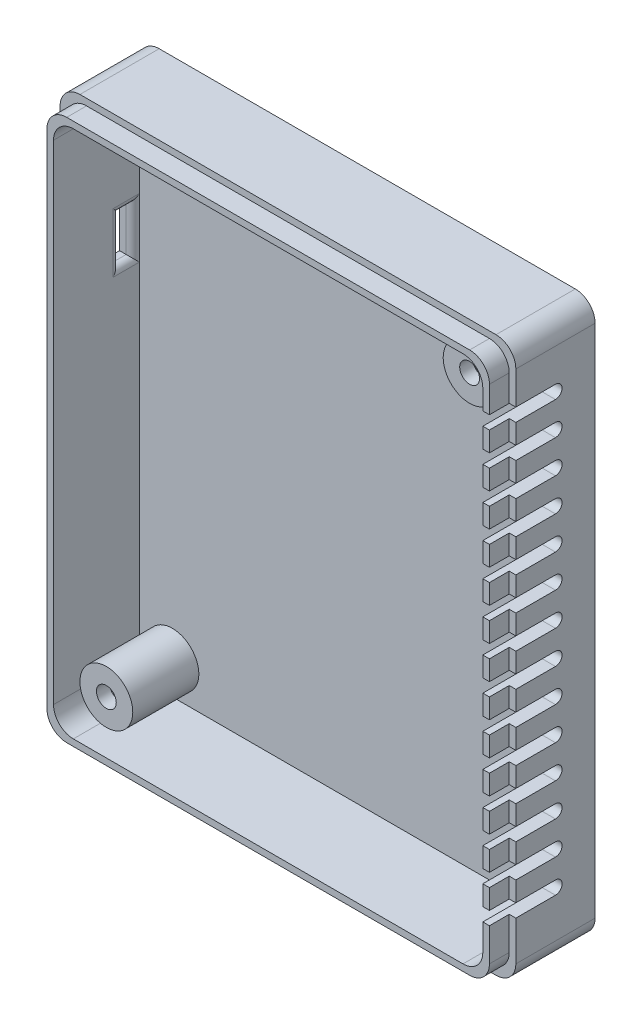
from build123d import *

# Parameters (mm, degrees)
SKETCH2_W           = 69
SKETCH2_H           = 84
SKETCH2_W_2         = 65
SKETCH2_H_2         = 80
BOSS_EXTRUDE1_DEPTH = 13
SKETCH3_OUTSIDE_W   = 92.896
SKETCH3_OUTSIDE_H   = 107.896
SKETCH3_OUTSIDE_W_2 = 67
SKETCH3_OUTSIDE_H_2 = 82
CUT_EXTRUDE1_DEPTH  = 3
SKETCH4_W           = 69
SKETCH4_H           = 84
BOSS_EXTRUDE2_DEPTH = 2
FILLET1_R           = 3
CUT_EXTRUDE2_DEPTH  = 3
LPATTERN1_COUNT     = 14
LPATTERN1_PITCH     = 5
SKETCH6_R           = 4
BOSS_EXTRUDE3_DEPTH = 10
CUT_EXTRUDE3_REACH  = 58.385
SKETCH7_R           = 3
FILLET2_R           = 2
BOSS_EXTRUDE4_START = -2
SKETCH8_R           = 4
SKETCH8_R_2         = 1.5
BOSS_EXTRUDE4_DEPTH = 2
SKETCH10_W          = 2
SKETCH10_H          = 7
CUT_EXTRUDE4_DEPTH  = 3
FILLET10_R          = 1


with BuildPart() as part:
    # Sketch2 → Boss-Extrude1 (new body)
    with BuildSketch(Plane.XY):
        Rectangle(SKETCH2_W, SKETCH2_H)
        Rectangle(SKETCH2_W_2, SKETCH2_H_2, mode=Mode.SUBTRACT)
    extrude(amount=BOSS_EXTRUDE1_DEPTH)

    # Sketch3 outside → Cut-Extrude1 (cut)
    with BuildSketch(Plane.XY.offset(13)):
        Rectangle(SKETCH3_OUTSIDE_W, SKETCH3_OUTSIDE_H)
        Rectangle(SKETCH3_OUTSIDE_W_2, SKETCH3_OUTSIDE_H_2, mode=Mode.SUBTRACT)
    extrude(amount=-CUT_EXTRUDE1_DEPTH, mode=Mode.SUBTRACT)

    # Sketch4 → Boss-Extrude2 (add)
    with BuildSketch(Plane(origin=(0, 0, 0), x_dir=(-1, 0, 0), z_dir=(0, 0, -1))):
        Rectangle(SKETCH4_W, SKETCH4_H)
    extrude(amount=BOSS_EXTRUDE2_DEPTH)

    # Fillet1
    fillet1_edges = [part.edges().sort_by_distance(p)[0] for p in [
        (32.5, -40, 6.5),
        (32.5, 40, 6.5),
        (-32.5, 40, 6.5),
        (-32.5, -40, 6.5),
        (34.5, -42, 4),
        (-34.5, -42, 4),
        (-34.5, 42, 4),
        (34.5, 42, 4),
        (33.5, -41, 11.5),
        (-33.5, -41, 11.5),
        (-33.5, 41, 11.5),
        (33.5, 41, 11.5),
    ]]
    fillet(fillet1_edges, radius=FILLET1_R)

    # Sketch5 → Cut-Extrude2 (cut)
    with BuildSketch(Plane(origin=(34.5, 0, 0), x_dir=(0, 0, -1), z_dir=(1, 0, 0))):
        with BuildLine():
            Line((-4, -33), (-13, -33))
            Line((-13, -33), (-13, -31))
            Line((-13, -31), (-4, -31))
            ThreePointArc((-4, -31), (-3, -32), (-4, -33))
        make_face()
    cut_extrude2 = extrude(amount=-CUT_EXTRUDE2_DEPTH, mode=Mode.SUBTRACT)

    # LPattern1: Cut-Extrude2 ×14
    with Locations(*[(0, i * LPATTERN1_PITCH, 0) for i in range(1, LPATTERN1_COUNT)]):
        add(cut_extrude2, mode=Mode.SUBTRACT)

    # Sketch6 → Boss-Extrude3 (add)
    with BuildSketch(Plane.XY):
        with Locations(Location((27.5, 35, 0), (0, 0, 180))):
            Circle(SKETCH6_R)
        with Locations(Location((-27.5, -35, 0), (0, 0, 180))):
            Circle(SKETCH6_R)
    extrude(amount=BOSS_EXTRUDE3_DEPTH)

    # Sketch7 → Cut-Extrude3 (cut, up to next)
    with BuildSketch(Plane(origin=(0, 0, -2), x_dir=(-1, 0, 0), z_dir=(0, 0, -1)), mode=Mode.PRIVATE) as cut_extrude3_sk1:
        with Locations((27.5, -35)):
            Circle(SKETCH7_R)
    cut_extrude3_tool1 = extrude(cut_extrude3_sk1.sketch, amount=-CUT_EXTRUDE3_REACH, mode=Mode.PRIVATE) & part.part
    # Sketch7 → Cut-Extrude3 (cut, up to next)
    with BuildSketch(Plane(origin=(0, 0, -2), x_dir=(-1, 0, 0), z_dir=(0, 0, -1)), mode=Mode.PRIVATE) as cut_extrude3_sk2:
        with Locations((-27.5, 35)):
            Circle(SKETCH7_R)
    cut_extrude3_tool2 = extrude(cut_extrude3_sk2.sketch, amount=-CUT_EXTRUDE3_REACH, mode=Mode.PRIVATE) & part.part
    add(cut_extrude3_tool1.solids().sort_by_distance((-27.5, -35, -2))[0], mode=Mode.SUBTRACT)
    add(cut_extrude3_tool2.solids().sort_by_distance((27.5, 35, -2))[0], mode=Mode.SUBTRACT)

    # Fillet2
    fillet2_edges = [part.edges().sort_by_distance(p)[0] for p in [
        (-24.5, -35, -2),
        (30.5, 35, -2),
    ]]
    fillet(fillet2_edges, radius=FILLET2_R)

    # Sketch8 → Boss-Extrude4 (add)
    # profile 1 of 2: a face of its own
    with BuildSketch(Plane.XY.offset(10).offset(BOSS_EXTRUDE4_START)):
        with Locations(Location((-27.5, -35, 0), (0, 0, 180))):
            Circle(SKETCH8_R)
        with Locations((-27.5, -35)):
            Circle(SKETCH8_R_2, mode=Mode.SUBTRACT)
    # profile 2 of 2: a face of its own
    with BuildSketch(Plane.XY.offset(10).offset(BOSS_EXTRUDE4_START)):
        with Locations(Location((27.5, 35, 0), (0, 0, 180))):
            Circle(SKETCH8_R)
        with Locations((27.5, 35)):
            Circle(SKETCH8_R_2, mode=Mode.SUBTRACT)
    extrude(amount=BOSS_EXTRUDE4_DEPTH)

    # Sketch10 → Cut-Extrude4 (cut)
    with BuildSketch(Plane.ZY.offset(34.5)):
        with Locations((2, 19.01524614)):
            Rectangle(SKETCH10_W, SKETCH10_H)
    extrude(amount=-CUT_EXTRUDE4_DEPTH, mode=Mode.SUBTRACT)

    # Fillet10
    fillet10_edges = [part.edges().sort_by_distance(p)[0] for p in [
        (-32.5, 22.51524614, 2),
        (-32.5, 19.01524614, 1),
        (-32.5, 15.51524614, 2),
        (-32.5, 19.01524614, 3),
    ]]
    fillet(fillet10_edges, radius=FILLET10_R - 0.0001)  # a hair under: the kernel refuses the full size


solid = part.part
